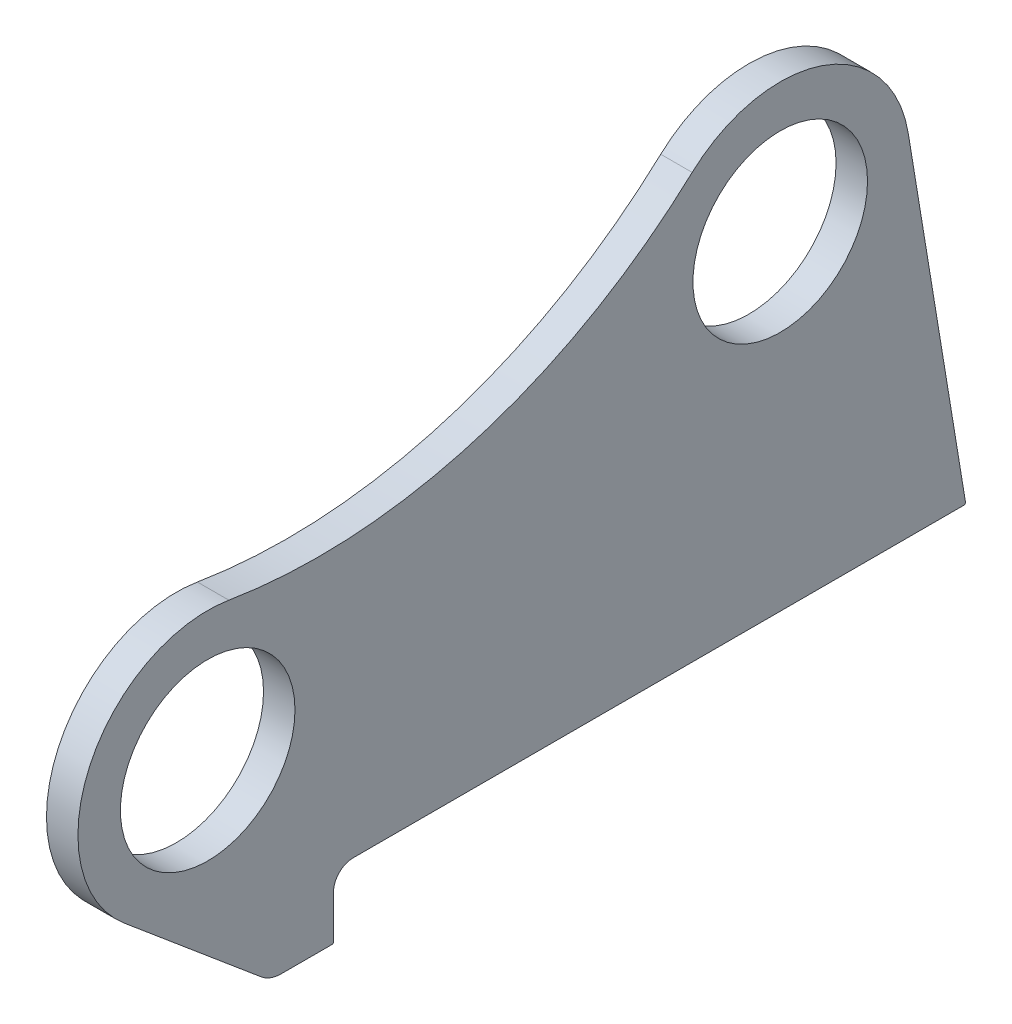
from build123d import *

# Parameters (mm, degrees)
SKETCH1_R          = 55.5
BASE_FLANGE1_DEPTH = 20
FILLET_1_0_R       = 1


# Sheet-metal steps are written as plain solids
with BuildPart() as part:
    # Sketch1 → Base-Flange1 (new body)
    with BuildSketch(Plane(origin=(0, 0, 0), x_dir=(0, 0, -1), z_dir=(1, 0, 0))):
        with BuildLine():
            Line((0, -41), (0, -12.5))
            ThreePointArc((0, -12.5), (3.661165235, -3.661165235), (12.5, 0))
            Line((12.5, 0), (402, 0))
            Line((402, 0), (365.427066504, 222.423621298))
            ThreePointArc((365.427066504, 222.423621298), (310.830481873, 287.060137522), (228.035448315, 269.634618846))
            ThreePointArc((228.035448315, 269.634618846), (90.953981912, 191.429564728), (-66.547391471, 181.395806549))
            ThreePointArc((-66.547391471, 181.395806549), (-154.948834301, 134.480751686), (-133.058215758, 36.825038658))
            Line((-133.058215758, 36.825038658), (-45.972209781, -36.315142143))
            ThreePointArc((-45.972209781, -36.315142143), (-39.95421417, -39.792323471), (-33.109612021, -41))
            Line((-33.109612021, -41), (0, -41))
        make_face()
        with Locations((-80, 100)):
            Circle(SKETCH1_R, mode=Mode.SUBTRACT)
        with Locations((284.02022345, 209.037960909)):
            Circle(SKETCH1_R, mode=Mode.SUBTRACT)
    extrude(amount=-BASE_FLANGE1_DEPTH)

    # Fillet-1.0
    fillet_1_0_edges = [part.edges().sort_by_distance(p)[0] for p in [
        (-10, 0, -402),
        (-10, -41, 0),
    ]]
    fillet(fillet_1_0_edges, radius=FILLET_1_0_R)


solid = part.part
